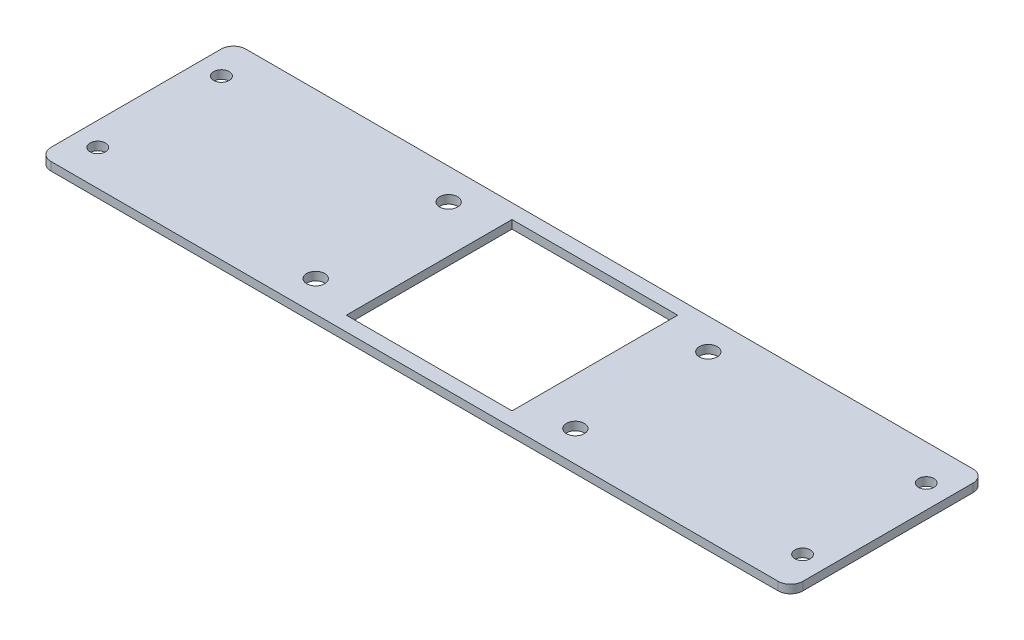
from build123d import *

# Parameters (mm, degrees)
SKETCH2_W           = 121.6
SKETCH2_H           = 31.5
SKETCH2_R           = 1.25
BOSS_EXTRUDE1_DEPTH = 1.35
FILLET1_R           = 2
SKETCH3_R           = 1.45
SKETCH3_W           = 26.8
SKETCH3_H           = 26.8
CUT_EXTRUDE1_DEPTH  = 63.821373751


with BuildPart() as part:
    # Sketch2 → Boss-Extrude1 (new body)
    with BuildSketch(Plane(origin=(0, 0, 0), x_dir=(1, 0, 0), z_dir=(0, 1, 0))):
        Rectangle(SKETCH2_W, SKETCH2_H)
        with Locations((-57, 10)):
            Circle(SKETCH2_R, mode=Mode.SUBTRACT)
        with Locations((-57, -10)):
            Circle(SKETCH2_R, mode=Mode.SUBTRACT)
        with Locations((57, 10)):
            Circle(SKETCH2_R, mode=Mode.SUBTRACT)
        with Locations((57, -10)):
            Circle(SKETCH2_R, mode=Mode.SUBTRACT)
    extrude(amount=-BOSS_EXTRUDE1_DEPTH)

    # Fillet1
    fillet1_edges = [part.edges().sort_by_distance(p)[0] for p in [
        (-60.8, -0.675, -15.75),
        (60.8, -0.675, -15.75),
        (60.8, -0.675, 15.75),
        (-60.8, -0.675, 15.75),
    ]]
    fillet(fillet1_edges, radius=FILLET1_R)

    # Sketch3 → Cut-Extrude1 (cut, through all)
    with BuildSketch(Plane(origin=(0, 0, 0), x_dir=(1, 0, 0), z_dir=(0, 1, 0))):
        with Locations((-21, 10.75)):
            Circle(SKETCH3_R)
        with Locations((21, 10.75)):
            Circle(SKETCH3_R)
        with Locations((21, -10.75)):
            Circle(SKETCH3_R)
        with Locations((-21, -10.75)):
            Circle(SKETCH3_R)
        Rectangle(SKETCH3_W, SKETCH3_H)
    extrude(amount=-CUT_EXTRUDE1_DEPTH, mode=Mode.SUBTRACT)


solid = part.part
